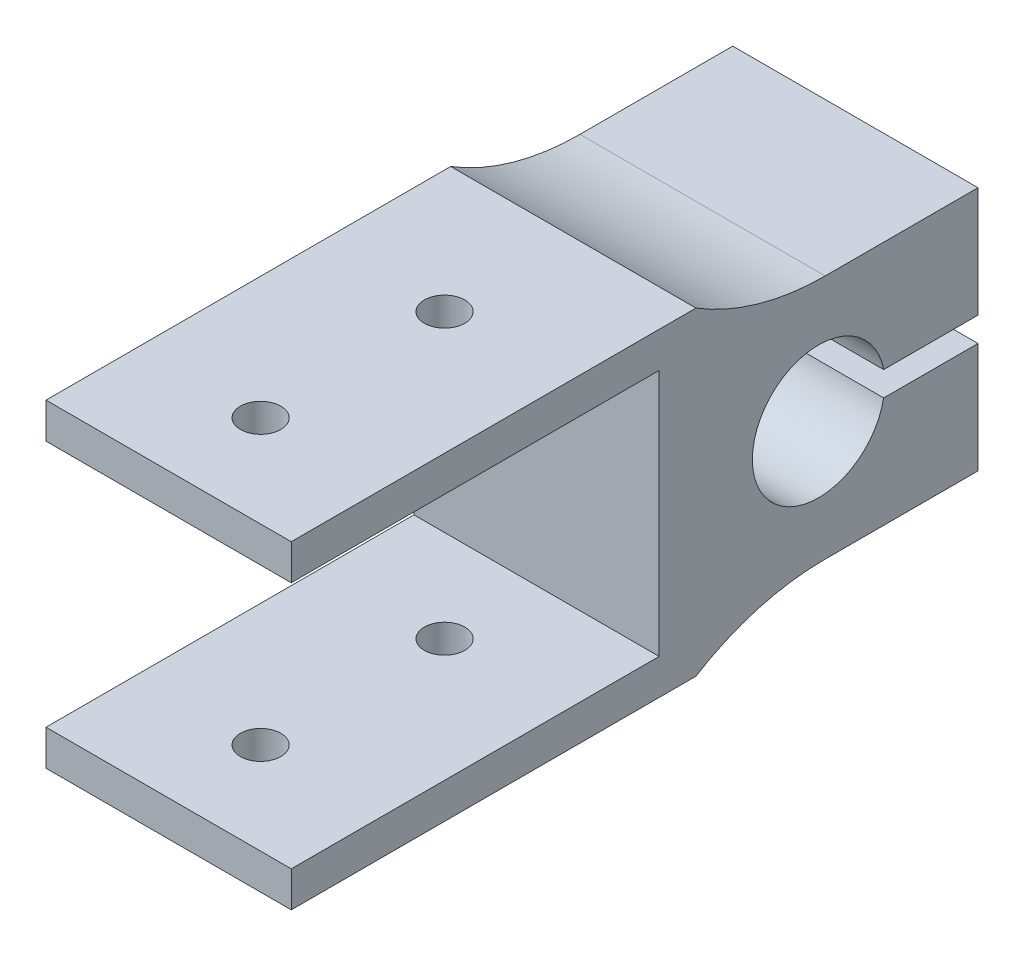
from build123d import *

# Parameters (mm, degrees)
SKETCH_2_W          = 20
SKETCH_2_H          = 26
EXTRUDE_1_DEPTH     = 3
SKETCH_3_W          = 20
SKETCH_3_H          = 2.9
EXTRUDE_2_DEPTH     = 30
SKETCH_4_R          = 1.65
CUT_EXTRUDE_1_DEPTH = 23.1
SKETCH_5_W          = 20
SKETCH_5_H          = 20
EXTRUDE_3_DEPTH     = 20
SKETCH_6_R          = 5.4
CUT_EXTRUDE_2_DEPTH = 20
CUT_EXTRUDE_3_DEPTH = 20
SKETCH_8_W          = 20
SKETCH_8_H          = 9
EXTRUDE_4_DEPTH     = 3
SKETCH_9_R          = 1.65
CUT_EXTRUDE_4_DEPTH = 16
SKETCH_10_R         = 3
CUT_EXTRUDE_5_DEPTH = 3.5
CUT_EXTRUDE_START   = -2
CUT_EXTRUDE_6_DEPTH = 3
SKETCH_12_R         = 1.65
CUT_EXTRUDE_7_DEPTH = 2
FILLET_1_R          = 20


with BuildPart() as part:
    # Эскиз2 → Бобышка-Вытянуть1 (new body)
    with BuildSketch(Plane.XY):
        Rectangle(SKETCH_2_W, SKETCH_2_H)
    extrude(amount=EXTRUDE_1_DEPTH)

    # Эскиз3 → Бобышка-Вытянуть2 (add)
    with BuildSketch(Plane.XY.offset(3)):
        with Locations((0, 11.55)):
            Rectangle(SKETCH_3_W, SKETCH_3_H)
        with Locations((0, -11.55)):
            Rectangle(SKETCH_3_W, SKETCH_3_H)
    extrude(amount=EXTRUDE_2_DEPTH)

    # Эскиз4 → Вырез-Вытянуть1 (cut)
    with BuildSketch(Plane(origin=(0, 13, 0), x_dir=(1, 0, 0), z_dir=(0, 1, 0))):
        with Locations(Location((0, -10.5, 0), (0, 0, 180))):
            Circle(SKETCH_4_R)
        with Locations(Location((0, -25.5, 0), (0, 0, 180))):
            Circle(SKETCH_4_R)
    cut_extrude_1 = extrude(amount=-CUT_EXTRUDE_1_DEPTH, mode=Mode.SUBTRACT)

    # Зеркальное отражение1: Вырез-Вытянуть1 across plane
    add(cut_extrude_1.mirror(Plane.ZX), mode=Mode.SUBTRACT)

    # Эскиз5 → Бобышка-Вытянуть3 (add)
    with BuildSketch(Plane(origin=(0, 0, 0), x_dir=(-1, 0, 0), z_dir=(0, 0, -1))):
        Rectangle(SKETCH_5_W, SKETCH_5_H)
    extrude(amount=EXTRUDE_3_DEPTH)

    # Эскиз6 → Вырез-Вытянуть2 (cut)
    with BuildSketch(Plane(origin=(10, 0, 0), x_dir=(0, 0, -1), z_dir=(1, 0, 0))):
        with Locations(Location((10, 0, 0), (0, 0, 90))):
            Circle(SKETCH_6_R)
    extrude(amount=-CUT_EXTRUDE_2_DEPTH, mode=Mode.SUBTRACT)

    # Эскиз7 → Вырез-Вытянуть3 (cut)
    with BuildSketch(Plane(origin=(10, 0, 0), x_dir=(0, 0, -1), z_dir=(1, 0, 0))):
        with BuildLine():
            Line((15.306599665, 1), (20, 1))
            Line((20, 1), (20, -1))
            Line((20, -1), (15.306599665, -1))
            ThreePointArc((15.306599665, -1), (15.4, 0), (15.306599665, 1))
        make_face()
    extrude(amount=-CUT_EXTRUDE_3_DEPTH, mode=Mode.SUBTRACT)

    # Эскиз8 → Бобышка-Вытянуть4 (add)
    with BuildSketch(Plane(origin=(0, 0, -20), x_dir=(-1, 0, 0), z_dir=(0, 0, -1))):
        with Locations((0, 5.5)):
            Rectangle(SKETCH_8_W, SKETCH_8_H)
        with Locations((0, -5.5)):
            Rectangle(SKETCH_8_W, SKETCH_8_H)
    extrude(amount=EXTRUDE_4_DEPTH)

    # Эскиз9 → Вырез-Вытянуть4 (cut)
    with BuildSketch(Plane.XZ.offset(10)):
        with Locations(Location((0, -19.153299832, 0), (0, 0, 270))):
            Circle(SKETCH_9_R)
    extrude(amount=-CUT_EXTRUDE_4_DEPTH, mode=Mode.SUBTRACT)

    # Эскиз10 → Вырез-Вытянуть5 (cut)
    with BuildSketch(Plane.XZ.offset(10)):
        with Locations(Location((0, -19.153299832, 0), (0, 0, 270))):
            Circle(SKETCH_10_R)
    extrude(amount=-CUT_EXTRUDE_5_DEPTH, mode=Mode.SUBTRACT)

    # Эскиз11 → Вырез-Вытянуть6 (cut)
    with BuildSketch(Plane.XZ.offset(-1).offset(CUT_EXTRUDE_START)):
        Polygon((3, -23), (3, -17.421249025), (0, -15.689198217), (-3, -17.421249025), (-3, -23), align=None)
    extrude(amount=-CUT_EXTRUDE_6_DEPTH, mode=Mode.SUBTRACT)

    # Эскиз12 → Вырез-Вытянуть7 (cut)
    with BuildSketch(Plane.XZ.offset(-6)):
        with Locations(Location((0, -19.153299832, 0), (0, 0, 270))):
            Circle(SKETCH_12_R)
    extrude(amount=-CUT_EXTRUDE_7_DEPTH, mode=Mode.SUBTRACT)

    # Скругление1
    # the kernel refuses this fillet: 20 mm, written as the material it adds along each edge
    with BuildSketch(Plane(origin=(10, -10, 0), x_dir=(0, 0, -1), z_dir=(-1, 0, 0))) as fillet_1_piece_1:
        with BuildLine():
            CenterArc((10.535653753, 20), FILLET_1_R, 238.211669383, 31.788330617)
            Line((0, 3), (0, 0))
            Line((0, 0), (10.535653753, 0))
        make_face()
    extrude(amount=20)
    with BuildSketch(Plane(origin=(-10, 10, 0), x_dir=(0, 1, 0), z_dir=(1, 0, 0))) as fillet_1_piece_2:
        with BuildLine():
            CenterArc((20, -10.535653753), FILLET_1_R, 148.211669383, 31.788330617)
            Line((0, -10.535653753), (0, 0))
            Line((0, 0), (3, 0))
        make_face()
    extrude(amount=20)


solid = part.part
